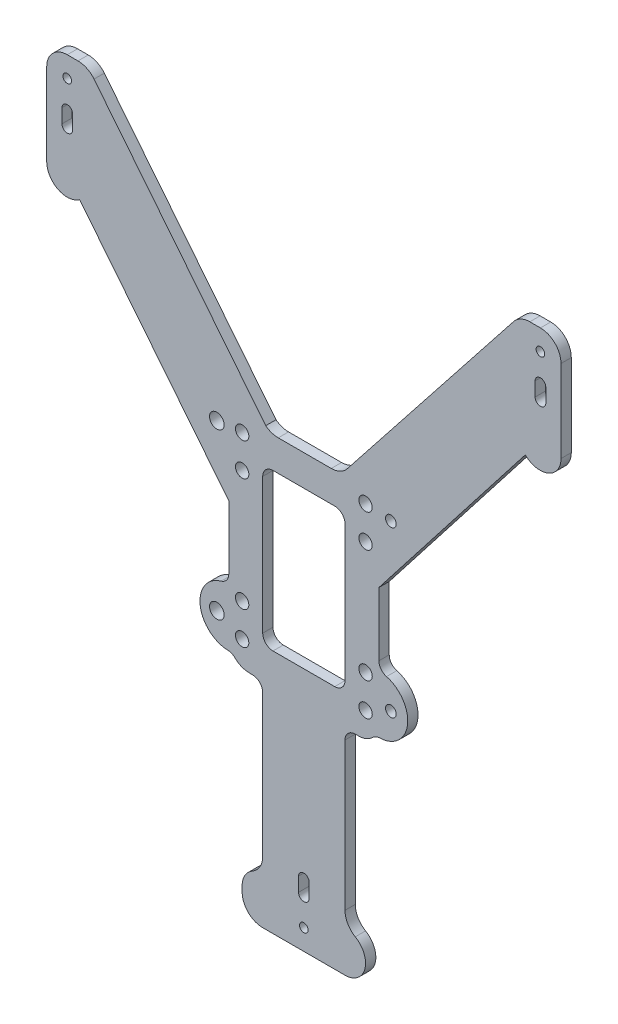
from build123d import *

# Parameters (mm, degrees)
BASE_FLANGE1_DEPTH         = 5
F_5_2_5_2_DIAMETER_HOLE1_D = 5.2
F_7_1_7_1_DIAMETER_HOLE1_D = 7.1
F_6_5_6_5_DIAMETER_HOLE1_D = 6.5
F_4_2_4_2_DIAMETER_HOLE1_D = 4.2


# Sheet-metal steps are written as plain solids
with BuildPart() as part:
    # Sketch7 → Base-Flange1 (new body)
    with BuildSketch(Plane.XY.offset(5)):
        with BuildLine():
            Line((-30, -147.320508076), (-30, -150))
            ThreePointArc((-30, -150), (-27.071067812, -157.071067812), (-20, -160))
            Line((-20, -160), (20, -160))
            ThreePointArc((20, -160), (29.659258263, -152.588190451), (25, -141.339745962))
            ThreePointArc((25, -141.339745962), (21.339745962, -137.679491924), (20, -132.679491924))
            Line((20, -132.679491924), (20, -61))
            ThreePointArc((20, -61), (21.464466094, -57.464466094), (25, -56))
            Line((25, -56), (26.5, -56))
            ThreePointArc((26.5, -56), (30.291825885, -55.253218708), (33.517318844, -53.124411291))
            ThreePointArc((33.517318844, -53.124411291), (35.066201479, -52.086695747), (36.887562932, -51.688533184))
            ThreePointArc((36.887562932, -51.688533184), (50.4004845, -39.360191171), (40.184210526, -24.187359787))
            ThreePointArc((40.184210526, -24.187359787), (37.526402929, -22.398480791), (36.5, -19.363595898))
            Line((36.5, -19.363595898), (36.5, 11.495546893))
            Line((36.5, 11.495546893), (107.655738061, 102.897284867))
            ThreePointArc((107.655738061, 102.897284867), (111.029837924, 100.693170117), (115, 100))
            ThreePointArc((115, 100), (122.071067812, 102.928932188), (125, 110))
            Line((125, 110), (125, 150))
            ThreePointArc((125, 150), (122.071067812, 157.071067812), (115, 160))
            Line((115, 160), (109.8448211, 160))
            ThreePointArc((109.8448211, 160), (105.484755829, 158.999435028), (101.997196274, 156.197966166))
            Line((101.997196274, 156.197966166), (20.637667976, 53.183681001))
            ThreePointArc((20.637667976, 53.183681001), (17.310502968, 50.830398319), (13.320715378, 50))
            Line((13.320715378, 50), (-12.442983516, 50))
            ThreePointArc((-12.442983516, 50), (-15.658335228, 50.531023637), (-18.532201388, 52.067697326))
            Line((-18.532201388, 52.067697326), (-101.997626249, 156.252326096))
            ThreePointArc((-101.997626249, 156.252326096), (-105.473226973, 159.014523308), (-109.802010811, 160))
            Line((-109.802010811, 160), (-115, 160))
            ThreePointArc((-115, 160), (-122.071067812, 157.071067812), (-125, 150))
            Line((-125, 150), (-125, 110))
            ThreePointArc((-125, 110), (-119.472924821, 101.056122567), (-109.001411291, 101.998941726))
            Line((-109.001411291, 101.998941726), (-36.5, 11.5))
            Line((-36.5, 11.5), (-36.5, -19.363595898))
            ThreePointArc((-36.5, -19.363595898), (-37.526402929, -22.398480791), (-40.184210526, -24.187359787))
            ThreePointArc((-40.184210526, -24.187359787), (-50.4004845, -39.360191171), (-36.887562932, -51.688533184))
            ThreePointArc((-36.887562932, -51.688533184), (-35.066201479, -52.086695747), (-33.517318844, -53.124411291))
            ThreePointArc((-33.517318844, -53.124411291), (-30.291825885, -55.253218708), (-26.5, -56))
            Line((-26.5, -56), (-25, -56))
            ThreePointArc((-25, -56), (-21.464466094, -57.464466094), (-20, -61))
            Line((-20, -61), (-20, -130))
            ThreePointArc((-20, -130), (-21.339745962, -135), (-25, -138.660254038))
            ThreePointArc((-25, -138.660254038), (-28.660254038, -142.320508076), (-30, -147.320508076))
        make_face()
        with BuildLine():
            Line((117.6, 136.4), (117.6, 129.6))
            ThreePointArc((117.6, 129.6), (115, 127), (112.4, 129.6))
            Line((112.4, 129.6), (112.4, 136.4))
            ThreePointArc((112.4, 136.4), (115, 139), (117.6, 136.4))
        make_face(mode=Mode.SUBTRACT)
        with BuildLine():
            Line((-112.4, 136.4), (-112.4, 129.6))
            ThreePointArc((-112.4, 129.6), (-115, 127), (-117.6, 129.6))
            Line((-117.6, 129.6), (-117.6, 136.4))
            ThreePointArc((-117.6, 136.4), (-115, 139), (-112.4, 136.4))
        make_face(mode=Mode.SUBTRACT)
        with BuildLine():
            Line((2.6, -129.6), (2.6, -136.4))
            ThreePointArc((2.6, -136.4), (0, -139), (-2.6, -136.4))
            Line((-2.6, -136.4), (-2.6, -129.6))
            ThreePointArc((-2.6, -129.6), (0, -127), (2.6, -129.6))
        make_face(mode=Mode.SUBTRACT)
        with BuildLine():
            Line((-20, -36), (-20, 30))
            ThreePointArc((-20, 30), (-18.535533906, 33.535533906), (-15, 35))
            Line((-15, 35), (15, 35))
            ThreePointArc((15, 35), (18.535533906, 33.535533906), (20, 30))
            Line((20, 30), (20, -36))
            ThreePointArc((20, -36), (18.535533906, -39.535533906), (15, -41))
            Line((15, -41), (-15, -41))
            ThreePointArc((-15, -41), (-18.535533906, -39.535533906), (-20, -36))
        make_face(mode=Mode.SUBTRACT)
    extrude(amount=-BASE_FLANGE1_DEPTH)

    # Ø5.2 (5.2) Diameter Hole1 (through all)
    with Locations(Plane.XY.offset(5)):
        with Locations((42.3, -37.693898678), (42.3, 42.306101322)):
            Hole(F_5_2_5_2_DIAMETER_HOLE1_D / 2)

    # Ø7.1 (7.1) Diameter Hole1 (through all)
    with Locations(Plane.XY.offset(5)):
        with Locations((-42.3, -37.693898678), (-42.3, 42.306101322)):
            Hole(F_7_1_7_1_DIAMETER_HOLE1_D / 2)

    # Ø6.5 (6.5) Diameter Hole1 (through all)
    with Locations(Plane.XY.offset(5)):
        with Locations((-30, -43.5), (-30, 43.5), (-30, -27.5), (-30, 27.5), (30, -43.5), (30, -27.5), (30, 27.5), (30, 43.5)):
            Hole(F_6_5_6_5_DIAMETER_HOLE1_D / 2)

    # Ø4.2 (4.2) Diameter Hole1 (through all)
    with Locations(Plane.XY.offset(5)):
        with Locations((0, -150), (-115, 150), (115, 150)):
            Hole(F_4_2_4_2_DIAMETER_HOLE1_D / 2)


solid = part.part
